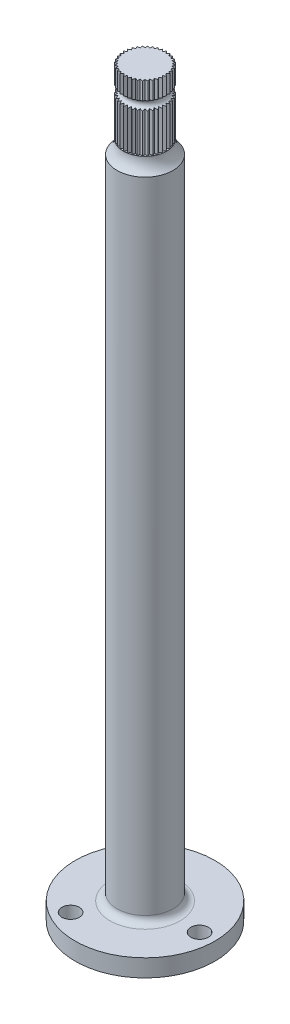
from build123d import *

# Parameters (mm, degrees)
SKETCH2_R           = 10.16
BOSS_EXTRUDE1_DEPTH = 234.95
SKETCH3_R           = 7.874
BOSS_EXTRUDE2_DEPTH = 28.575
FILLET1_R           = 6.35
SKETCH5_R           = 25.4
BOSS_EXTRUDE3_DEPTH = 6.35
FILLET2_R           = 2.54
CUT_EXTRUDE13_DEPTH = 23.622
CIRPATTERN2_COUNT   = 36
SKETCH21_R          = 1.5875
SKETCH16_R          = 6.985
SKETCH16_R_2        = 3.175
CUT_EXTRUDE14_DEPTH = 241.3


with BuildPart() as part:
    # Sketch2 → Boss-Extrude1 (new body)
    with BuildSketch(Plane(origin=(0, 0, 0), x_dir=(1, 0, 0), z_dir=(0, 1, 0))):
        with Locations(Location((0, 0, 0), (0, 0, 270))):
            Circle(SKETCH2_R)
    extrude(amount=BOSS_EXTRUDE1_DEPTH)

    # Sketch3 → Boss-Extrude2 (add)
    with BuildSketch(Plane(origin=(0, 234.95, 0), x_dir=(1, 0, 0), z_dir=(0, 1, 0))):
        with Locations(Location((0, 0, 0), (0, 0, 270))):
            Circle(SKETCH3_R)
    extrude(amount=BOSS_EXTRUDE2_DEPTH)

    # Fillet1
    # the kernel refuses this fillet: 6.35 mm, written as the material it adds along each edge
    with BuildSketch(Plane(origin=(0, 234.95, 0), x_dir=(0, 0, 1), z_dir=(-1, 0, 0))) as fillet1_piece_1:
        with BuildLine():
            CenterArc((14.224, 4.879180669), FILLET1_R, 180, 50.2081805)
            Line((7.874, 4.879180669), (7.747, 4.879180669))
            Line((7.747, 4.879180669), (7.747, 0))
            Line((7.747, 0), (7.874, -0.127))
            ThreePointArc((7.874, -0.127), (9.017, -0.127), (10.07872, -0.097583613))
            Line((10.07872, -0.097583613), (10.16, 0))
        make_face()
    revolve(axis=Axis((0, 234.95, 0), (0, 1, 0)))

    # Sketch5 → Boss-Extrude3 (add)
    with BuildSketch(Plane.XZ):
        with Locations(Location((0, 0, 0), (0, 0, 270))):
            Circle(SKETCH5_R)
    extrude(amount=BOSS_EXTRUDE3_DEPTH)

    # Fillet2
    fillet2_edges = [part.edges().sort_by_distance(p)[0] for p in [
        (0, 0, -10.16),
    ]]
    fillet(fillet2_edges, radius=FILLET2_R)

    # Sketch18 → Cut-Extrude13 (cut)
    with BuildSketch(Plane(origin=(0, 263.525, 0), x_dir=(1, 0, 0), z_dir=(0, 1, 0))):
        Polygon((0, 7.874), (-0.577413578, 6.997046807), (-1.420220325, 7.7448596), (-1.564124087, 7.874), (0.153264375, 8.011288466), (0.08013608, 7.94312534), align=None)
    cut_extrude13 = extrude(amount=-CUT_EXTRUDE13_DEPTH, mode=Mode.SUBTRACT)

    # CirPattern2: Cut-Extrude13 ×36 about axis
    cirpattern2_axis = Axis((0, 0, 0), (0, 1, 0))
    for i in range(1, CIRPATTERN2_COUNT):
        add(cut_extrude13.rotate(cirpattern2_axis, i * 360 / CIRPATTERN2_COUNT), mode=Mode.SUBTRACT)

    # Sketch21 → Cut-Revolve1 (revolve, cut)
    with BuildSketch(Plane.XY, mode=Mode.PRIVATE) as cut_revolve1_sk:
        with Locations((7.952268605, 255.5875)):
            Circle(SKETCH21_R)
    revolve(cut_revolve1_sk.sketch.rotate(Axis((0, 270.784655195, 0), (0, -1, 0)), 270), axis=Axis((0, 270.784655195, 0), (0, -1, 0)), mode=Mode.SUBTRACT)

    # Sketch16 → Cut-Extrude14 (cut)
    with BuildSketch(Plane.XZ.offset(6.35)):
        with Locations(Location((0, 0, 0), (0, 0, 270))):
            Circle(SKETCH16_R)
        with Locations(Location((19.812, 0, 0), (0, 0, 270))):
            Circle(SKETCH16_R_2)
        with Locations(Location((-9.906, 17.1576953, 0), (0, 0, 270))):
            Circle(SKETCH16_R_2)
        with Locations(Location((-9.906, -17.1576953, 0), (0, 0, 270))):
            Circle(SKETCH16_R_2)
    extrude(amount=-CUT_EXTRUDE14_DEPTH, mode=Mode.SUBTRACT)


solid = part.part
